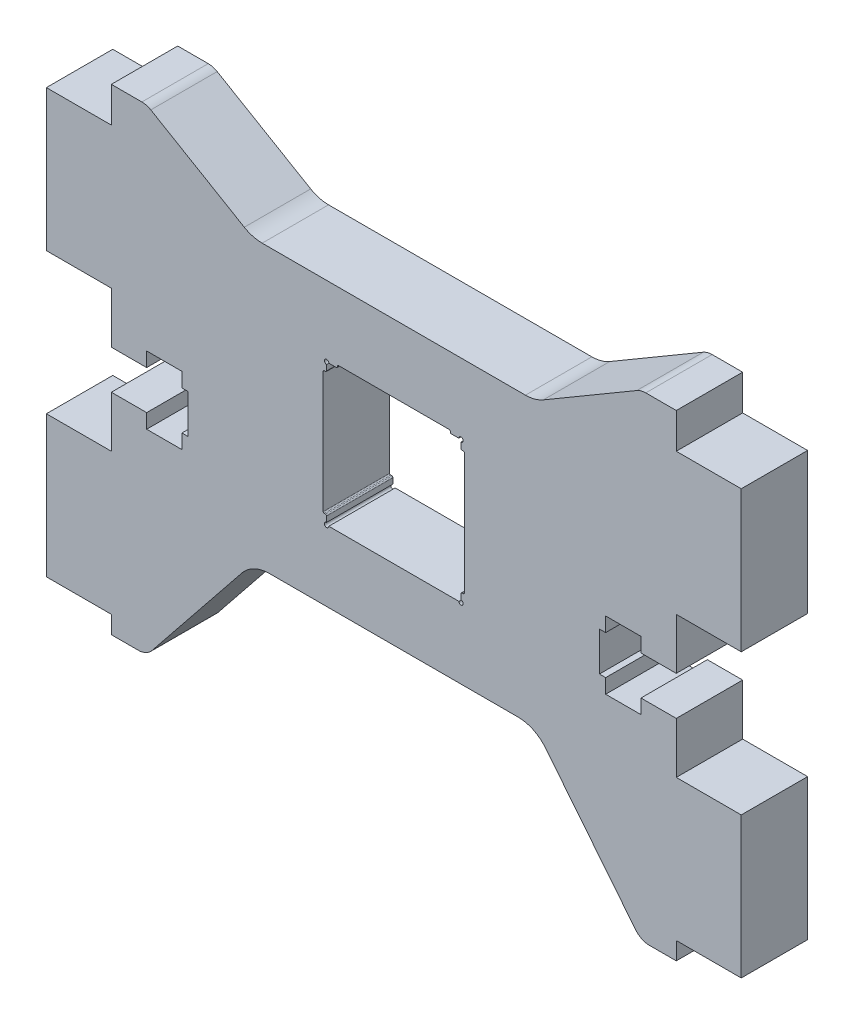
from build123d import *

# Parameters (mm, degrees)
SKETCH1_W           = 12.0904
SKETCH1_H           = 12.7
BOSS_EXTRUDE1_DEPTH = 5.969
CUT_EXTRUDE1_DEPTH  = 41.194496828
SKETCH3_R           = 0.1984375
CUT_EXTRUDE2_DEPTH  = 41.194496828
FILLET1_R           = 3.175
FILLET2_R           = 1.5875
SKETCH4_W           = 12.7
SKETCH4_H           = 11.1125
CUT_EXTRUDE3_DEPTH  = 41.194496828
FILLET7_R           = 0.1
SKETCH5_W           = 10.16
SKETCH5_H           = 0.5
CUT_EXTRUDE4_DEPTH  = 41.194496828
FILLET8_R           = 0.1


with BuildPart() as part:
    # Sketch1 → Boss-Extrude1 (new body)
    with BuildSketch(Plane.XY):
        Polygon((25.4, 2.413), (25.4, -10.287), (31.242, -10.287), (31.242, -22.987), (25.4, -22.987), (25.4, -24.5745), (22.225, -24.5745), (12.7, -12.7), (-12.7, -12.7), (-22.225, -24.5745), (-25.4, -24.5745), (-25.4, -22.987), (-31.242, -22.987), (-31.242, -10.287), (-25.4, -10.287), (-25.4, 2.413), (-31.242, 2.413), (-31.242, 15.113), (-25.4, 15.113), (-25.4, 18.288), (-22.225, 18.288), (-12.7, 12.7), (12.7, 12.7), (22.225, 18.288), (25.4, 18.288), (25.4, 15.113), (31.242, 15.113), (31.242, 2.413), align=None)
        Rectangle(SKETCH1_W, SKETCH1_H, mode=Mode.SUBTRACT)
    extrude(amount=BOSS_EXTRUDE1_DEPTH)

    # Sketch2 → Cut-Extrude1 (cut, through all)
    with BuildSketch(Plane.XY.offset(5.969)):
        Polygon((22.225, -2.1844), (22.225, -0.889), (19.05, -0.889), (19.05, -2.1844), (18.492, -2.1844), (18.492, -5.6896), (19.05, -5.6896), (19.05, -6.985), (22.225, -6.985), (22.225, -5.6896), (25.4, -5.6896), (25.4, -2.1844), align=None)
        Polygon((-19.05, -2.1844), (-19.05, -0.889), (-22.225, -0.889), (-22.225, -2.1844), (-25.4, -2.1844), (-25.4, -5.6896), (-22.225, -5.6896), (-22.225, -6.985), (-19.05, -6.985), (-19.05, -5.6896), (-18.492, -5.6896), (-18.492, -2.1844), align=None)
    extrude(amount=-CUT_EXTRUDE1_DEPTH, mode=Mode.SUBTRACT)

    # Sketch3 → Cut-Extrude2 (cut, through all)
    with BuildSketch(Plane.XY.offset(5.969)):
        with Locations((6.0452, 6.35)):
            Circle(SKETCH3_R)
        with Locations((-6.0452, 6.35)):
            Circle(SKETCH3_R)
        with Locations((-6.0452, -6.35)):
            Circle(SKETCH3_R)
        with Locations((6.0452, -6.35)):
            Circle(SKETCH3_R)
    extrude(amount=-CUT_EXTRUDE2_DEPTH, mode=Mode.SUBTRACT)

    # Fillet1
    fillet1_edges = [part.edges().sort_by_distance(p)[0] for p in [
        (-12.7, -12.7, 2.9845),
        (12.7, -12.7, 2.9845),
        (12.7, 12.7, 2.9845),
        (-12.7, 12.7, 2.9845),
    ]]
    fillet(fillet1_edges, radius=FILLET1_R)

    # Fillet2
    fillet2_edges = [part.edges().sort_by_distance(p)[0] for p in [
        (22.225, -24.5745, 2.9845),
        (-22.225, -24.5745, 2.9845),
        (-22.225, 18.288, 2.9845),
        (22.225, 18.288, 2.9845),
    ]]
    fillet(fillet2_edges, radius=FILLET2_R)

    # Sketch4 → Cut-Extrude3 (cut, through all)
    with BuildSketch(Plane.XY.offset(5.969)):
        Rectangle(SKETCH4_W, SKETCH4_H)
    extrude(amount=-CUT_EXTRUDE3_DEPTH, mode=Mode.SUBTRACT)

    # Fillet7
    fillet7_edges = [part.edges().sort_by_distance(p)[0] for p in [
        (6.35, -5.55625, 2.9845),
        (6.0452, -5.55625, 2.9845),
        (6.35, 5.55625, 2.9845),
        (6.0452, 5.55625, 2.9845),
        (-6.0452, 5.55625, 2.9845),
        (-6.35, 5.55625, 2.9845),
        (-6.35, -5.55625, 2.9845),
        (-6.0452, -5.55625, 2.9845),
    ]]
    fillet(fillet7_edges, radius=FILLET7_R)

    # Sketch5 → Cut-Extrude4 (cut, through all)
    with BuildSketch(Plane.XY.offset(5.969)):
        with Locations((0, 6.35)):
            Rectangle(SKETCH5_W, SKETCH5_H)
    extrude(amount=-CUT_EXTRUDE4_DEPTH, mode=Mode.SUBTRACT)

    # Fillet8
    fillet8_edges = [part.edges().sort_by_distance(p)[0] for p in [
        (5.08, 6.6, 2.9845),
        (5.08, 6.35, 2.9845),
        (-5.08, 6.6, 2.9845),
        (-5.08, 6.35, 2.9845),
    ]]
    fillet(fillet8_edges, radius=FILLET8_R)


solid = part.part
